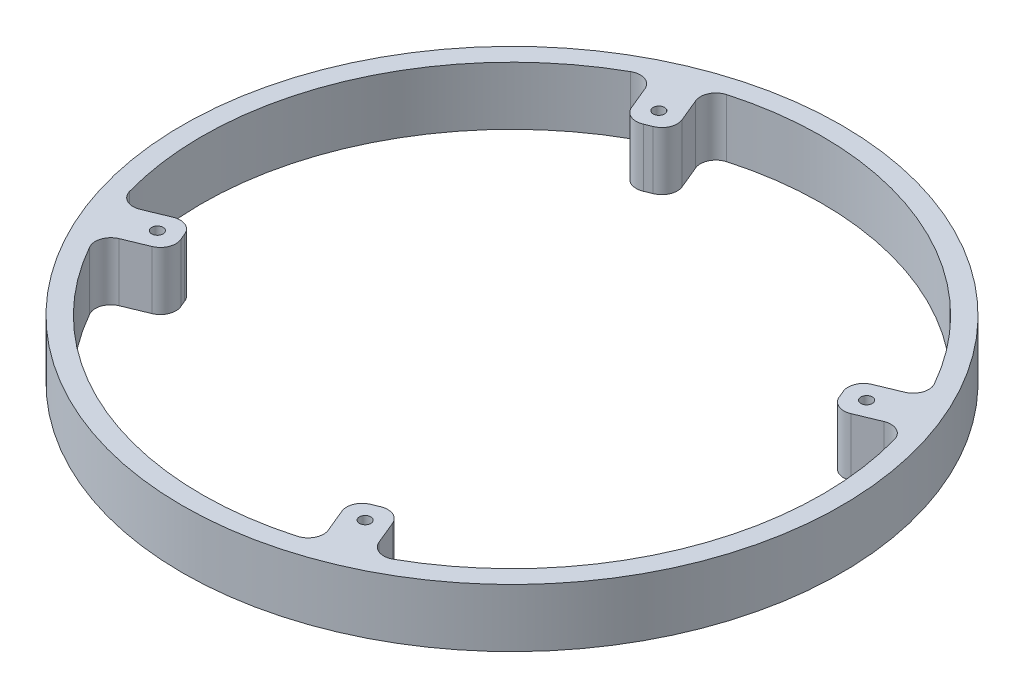
from build123d import *

# Parameters (mm, degrees)
SKETCH2_W                   = 19.99983
SKETCH2_H                   = 15
F_32_0_116_DIAMETER_HOLE1_D = 2.9464
CIRPATTERN3_COUNT           = 4
CUT_EXTRUDE1_DEPTH          = 122.14017583
FILLET1_R                   = 4
CIRPATTERN4_COUNT           = 4
FILLET1_OF_CIRPATTERN4_R    = 4


with BuildPart() as part:
    # Sketch2 → Revolve1 (revolve)
    with BuildSketch(Plane(origin=(0, 0, 0), x_dir=(0, 0, -1), z_dir=(1, 0, 0))):
        with Locations((-74.999915, 7.5)):
            Rectangle(SKETCH2_W, SKETCH2_H)
    revolve(axis=Axis((0, -0.75, 0), (0, 1, 0)))

    # #32 (0.116) Diameter Hole1 (through all)
    with Locations(Plane(origin=(0, 15, 0), x_dir=(1, 0, 0), z_dir=(0, 1, 0))):
        with Locations((-26.787840266, 64.671567276)):
            f_32_0_116_diameter_hole1 = Hole(F_32_0_116_DIAMETER_HOLE1_D / 2)

    # CirPattern3: #32 (0.116) Diameter Hole1 ×4 about axis
    cirpattern3_axis = Axis((0, -0.75, 0), (0, 1, 0))
    for i in range(1, CIRPATTERN3_COUNT):
        add(f_32_0_116_diameter_hole1.rotate(cirpattern3_axis, i * 360 / CIRPATTERN3_COUNT), mode=Mode.SUBTRACT)

    # Sketch8 → Cut-Extrude1 (cut, through all)
    with BuildSketch(Plane(origin=(0, 15, 0), x_dir=(1, 0, 0), z_dir=(0, 1, 0))):
        with BuildLine():
            Line((-4.754393761, 24.543751546), (-25.93535895, 75.67912497))
            ThreePointArc((-25.93535895, 75.67912497), (30.614609533, 73.910205541), (71.852290646, 35.174154275))
            Line((71.852290646, 35.174154275), (20.716917223, 13.993189086))
            ThreePointArc((20.716917223, 13.993189086), (9.567085809, 23.096988313), (-4.754393761, 24.543751546))
        make_face()
    cut_extrude1 = extrude(amount=-CUT_EXTRUDE1_DEPTH, mode=Mode.SUBTRACT)

    # Fillet1
    fillet1_edges = [part.edges().sort_by_distance(p)[0] for p in [
        (71.852290646, 7.5, -35.174154275),
        (-25.93535895, 7.5, -75.67912497),
        (57.960819706, 7.5, -29.42011861),
        (-20.181323285, 7.5, -61.78765403),
    ]]
    fillet(fillet1_edges, radius=FILLET1_R)

    # CirPattern4: Cut-Extrude1 ×4 about axis
    cirpattern4_axis = Axis((0, -0.75, 0), (0, 1, 0))
    for i in range(1, CIRPATTERN4_COUNT):
        add(cut_extrude1.rotate(cirpattern4_axis, i * 360 / CIRPATTERN4_COUNT), mode=Mode.SUBTRACT)

    # Fillet1 of CirPattern4
    fillet1_of_cirpattern4_edges = [part.edges().sort_by_distance(p)[0] for p in [
        (-35.174154275, 7.5, -71.852290646),
        (-75.67912497, 7.5, 25.93535895),
        (-29.42011861, 7.5, -57.960819706),
        (-61.78765403, 7.5, 20.181323285),
        (-71.852290646, 7.5, 35.174154275),
        (25.93535895, 7.5, 75.67912497),
        (-57.960819706, 7.5, 29.42011861),
        (20.181323285, 7.5, 61.78765403),
        (35.174154275, 7.5, 71.852290646),
        (75.67912497, 7.5, -25.93535895),
        (29.42011861, 7.5, 57.960819706),
        (61.78765403, 7.5, -20.181323285),
    ]]
    fillet(fillet1_of_cirpattern4_edges, radius=FILLET1_OF_CIRPATTERN4_R)


solid = part.part
